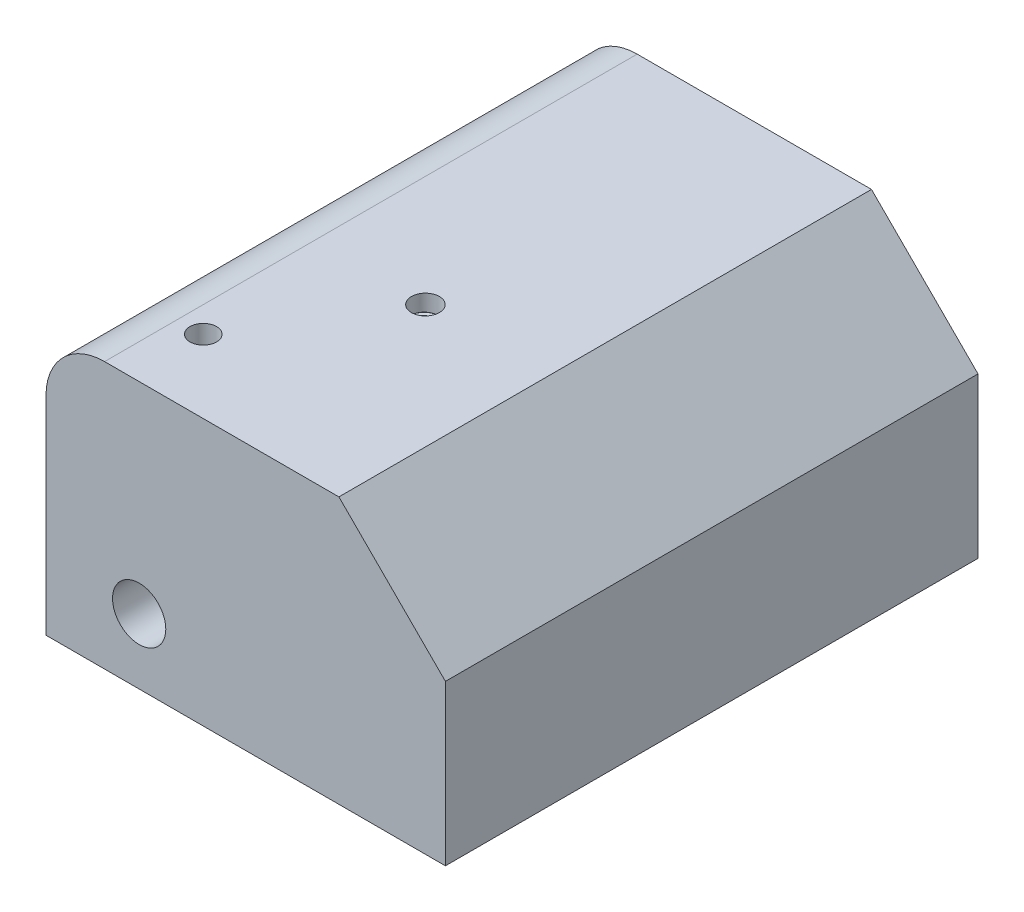
from build123d import *

# Parameters (mm, degrees)
BOSS_EXTRUDE1_DEPTH = 100
HOLE1_D             = 20
HOLE1_DEPTH         = 20
HOLE2_D             = 10
HOLE2_DEPTH         = 40
HOLE3_D             = 10.5
HOLE3_DEPTH         = 30
THREAD1_PITCH       = 1.5


with BuildPart() as part:
    # Sketch1 → Boss-Extrude1 (new, symmetric)
    with BuildSketch(Plane.XY):
        with BuildLine():
            Line((-40, 100), (0, 60))
            Line((0, 60), (0, 0))
            Line((0, 0), (-150, 0))
            Line((-150, 0), (-150, 78))
            ThreePointArc((-150, 78), (-143.556349186, 93.556349186), (-128, 100))
            Line((-128, 100), (-40, 100))
        make_face()
    extrude(amount=BOSS_EXTRUDE1_DEPTH, both=True)

    # Hole1
    with Locations(Plane.XY.offset(100)):
        with Locations((-115.014552572, 24.461701942)):
            Hole(HOLE1_D / 2, depth=HOLE1_DEPTH)

    # Hole2
    with Locations(Plane(origin=(0, 100, 0), x_dir=(1, 0, 0), z_dir=(0, 1, 0))):
        with Locations((-118.359140417, -72.579430698)):
            Hole(HOLE2_D / 2, depth=HOLE2_DEPTH)

    # Hole3
    with Locations(Plane(origin=(0, 100, 0), x_dir=(1, 0, 0), z_dir=(0, 1, 0))):
        with Locations((-86.311080109, -21.208275204)):
            Hole(HOLE3_D / 2, depth=HOLE3_DEPTH)

    # Thread1: the profile of Thread Profile1 profile screwed along a right-hand helix of 16 turns, 8 arcs to a turn; built about Z, then put on its axis
    thread1_z = Axis((0, 0, 0), (0, 0, 1))
    thread1_corners = [(5.2497, 0, -0.000173205), (6.061898812, 0, 0.468749998), (6.061898812, 0, 0.656249998), (5.2497, 0, 1.125173201)]
    with BuildLine(mode=Mode.PRIVATE) as thread1_profile:
        Line(thread1_corners[0], thread1_corners[1])
        Line(thread1_corners[1], thread1_corners[2])
        Line(thread1_corners[2], thread1_corners[3])
        Line(thread1_corners[3], thread1_corners[0])
    thread1_cap = Face(thread1_profile.wire())
    thread1_turn_angles = [0, 22.5, 45, 67.5, 90, 112.5, 135, 157.5, 180, 202.5, 225, 247.5, 270, 292.5, 315, 337.5, 360]
    thread1_turn_weights = [1, 0.9238795325112867, 1, 0.9238795325112867, 1, 0.9238795325112867, 1, 0.9238795325112867, 1, 0.9238795325112867, 1, 0.9238795325112867, 1, 0.9238795325112867, 1, 0.9238795325112867, 1]
    thread1_turn_rails = [Edge.make_bspline([Vector(p[0], p[1], 0).rotate(thread1_z, thread1_turn_angles[k]) / thread1_turn_weights[k] + Vector(0, 0, p[2] + THREAD1_PITCH * thread1_turn_angles[k] / 360) for k in range(17)], [0, 0, 0, 1, 1, 2, 2, 3, 3, 4, 4, 5, 5, 6, 6, 7, 7, 8, 8, 8], 2, thread1_turn_weights) for p in thread1_corners]
    thread1_turn_sides = [Face.make_surface_from_curves(thread1_turn_rails[p[0]], thread1_turn_rails[p[1]]) for p in [(0, 1), (1, 2), (2, 3), (3, 0)]]
    thread1 = Plane(origin=(-86.311080109, 94, 21.208275204), x_dir=(-1, 0, 0), z_dir=(0, -1, 0)) * Solid(Shell([*[p.moved(Location((0, 0, THREAD1_PITCH * i))) for i in range(16) for p in thread1_turn_sides], thread1_cap, thread1_cap.rotate(thread1_z, 5760).moved(Location((0, 0, THREAD1_PITCH * 5760 / 360)))]))
    add(thread1, mode=Mode.SUBTRACT)


solid = part.part
